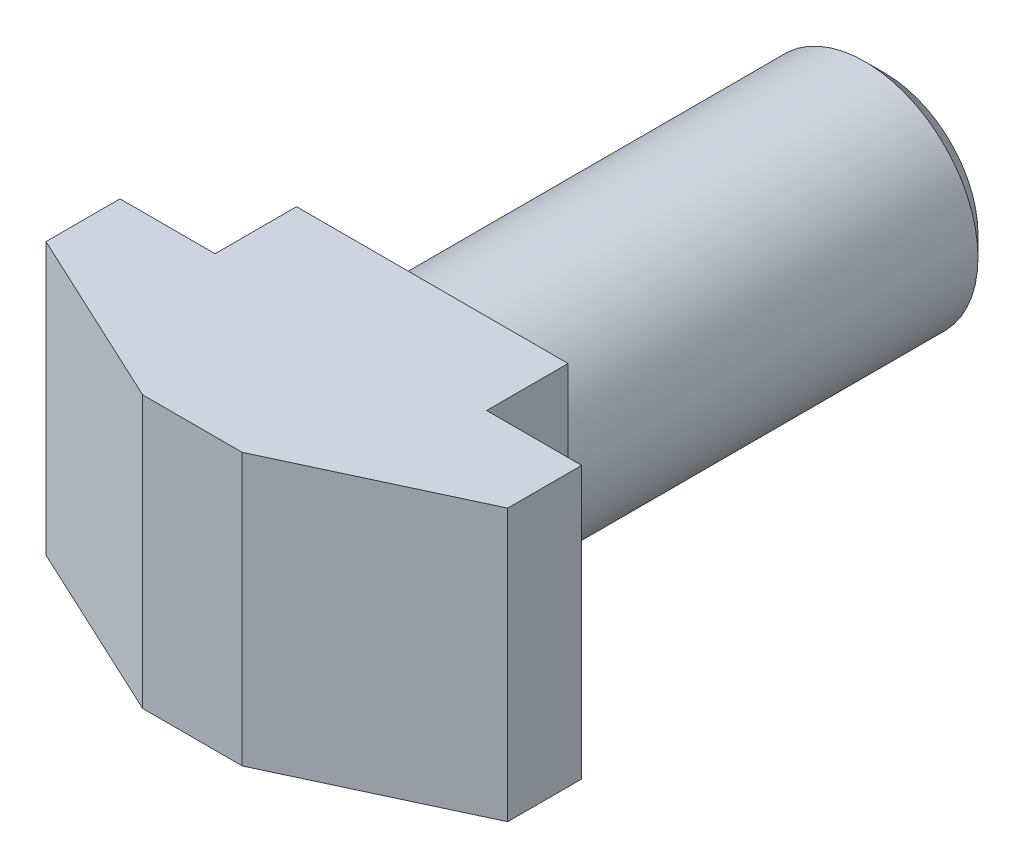
from build123d import *

# Parameters (mm, degrees)
BOSS_EXTRUDE1_DEPTH = 6
CHAMFER1_SIZE       = 4
CHAMFER1_SIZE2      = 1.865230633


# Read off the part's stored shape, not the designer's step: M5x0.8 Machine Threads Stud1
with BuildPart() as part:
    # Sketch1 → Boss-Extrude1 (new body)
    with BuildSketch(Plane(origin=(0, 0, 0), x_dir=(1, 0, 0), z_dir=(0, 1, 0))):
        Polygon((0, 0), (0, 3.5), (2.1, 3.5), (2.1, 5.3), (8.1, 5.3), (8.1, 3.5), (10.2, 3.5), (10.2, 0), align=None)
    extrude(amount=BOSS_EXTRUDE1_DEPTH)

    # M5x0.8 Machine Threads Stud1 outline → M5x0.8 Machine Threads Stud1 (revolve)
    with BuildSketch(Plane(origin=(5.1, 3, 0), x_dir=(1, 0, 0), z_dir=(0, -1, 0))):
        Polygon((0, -5.3), (0, -15.3), (2.055, -15.3), (2.5, -14.855), (2.5, -5.3), align=None)
    revolve(axis=Axis((5.1, 3, 0), (0, 0, 1)))

    # Chamfer1
    chamfer1_edges = [part.edges().sort_by_distance(p)[0] for p in [
        (0, 3, 0),
        (10.2, 3, 0),
    ]]
    chamfer1_side = [part.faces().sort_by_distance(p)[0] for p in [
        (5.1, 3, 0),
    ]]
    chamfer(chamfer1_edges, length=CHAMFER1_SIZE, length2=CHAMFER1_SIZE2, reference=chamfer1_side[0])


solid = part.part
